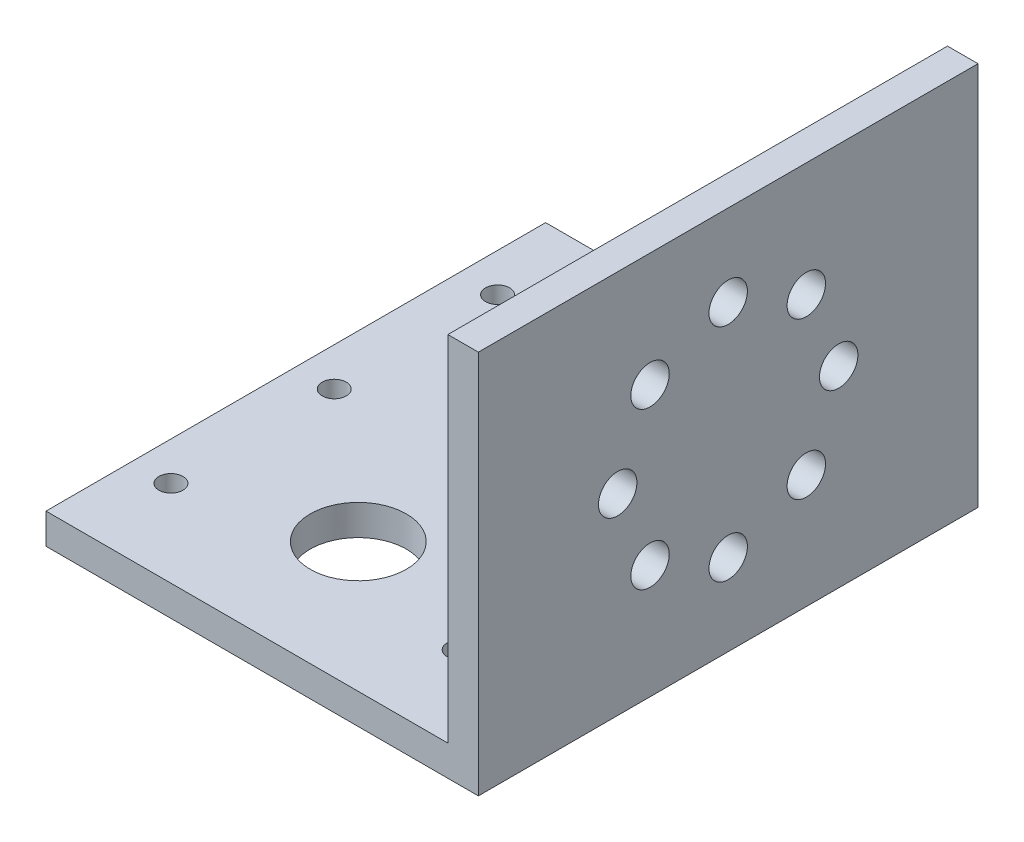
from build123d import *

# Parameters (mm, degrees)
BOSS_EXTRUDE1_DEPTH = 52
SKETCH2_R           = 2
CUT_EXTRUDE1_DEPTH  = 79.006926776
SKETCH3_R           = 1.25
SKETCH3_R_2         = 5
CUT_EXTRUDE2_DEPTH  = 78.803153053


with BuildPart() as part:
    # Sketch1 → Boss-Extrude1 (new body)
    with BuildSketch(Plane.XY):
        Polygon((0, 0), (0, 36.825), (3.175, 36.825), (3.175, -3.175), (-41.825, -3.175), (-41.825, 0), align=None)
    extrude(amount=BOSS_EXTRUDE1_DEPTH)

    # Sketch2 → Cut-Extrude1 (cut, through all)
    with BuildSketch(Plane(origin=(3.175, 0, 0), x_dir=(0, 0, -1), z_dir=(1, 0, 0))):
        with Locations((-26, 28.325)):
            Circle(SKETCH2_R)
        with Locations((-17.868272016, 24.956727984)):
            Circle(SKETCH2_R)
        with Locations((-14.5, 16.825)):
            Circle(SKETCH2_R)
        with Locations((-17.868272016, 8.693272016)):
            Circle(SKETCH2_R)
        with Locations((-26, 5.325)):
            Circle(SKETCH2_R)
        with Locations((-34.131727984, 8.693272016)):
            Circle(SKETCH2_R)
        with Locations((-37.5, 16.825)):
            Circle(SKETCH2_R)
        with Locations((-34.131727984, 24.956727984)):
            Circle(SKETCH2_R)
    extrude(amount=-CUT_EXTRUDE1_DEPTH, mode=Mode.SUBTRACT)

    # Sketch3 → Cut-Extrude2 (cut, through all)
    with BuildSketch(Plane(origin=(0, -3.175, 0), x_dir=(-1, 0, 0), z_dir=(0, -1, 0))):
        with Locations((7.825, -43)):
            Circle(SKETCH3_R)
        with Locations((37.825, -43)):
            Circle(SKETCH3_R)
        with Locations((37.825, -26)):
            Circle(SKETCH3_R)
        with Locations((37.825, -9)):
            Circle(SKETCH3_R)
        with Locations((7.825, -26)):
            Circle(SKETCH3_R)
        with Locations((7.825, -9)):
            Circle(SKETCH3_R)
        with Locations((22.825, -38.5)):
            Circle(SKETCH3_R_2)
    extrude(amount=-CUT_EXTRUDE2_DEPTH, mode=Mode.SUBTRACT)


solid = part.part
